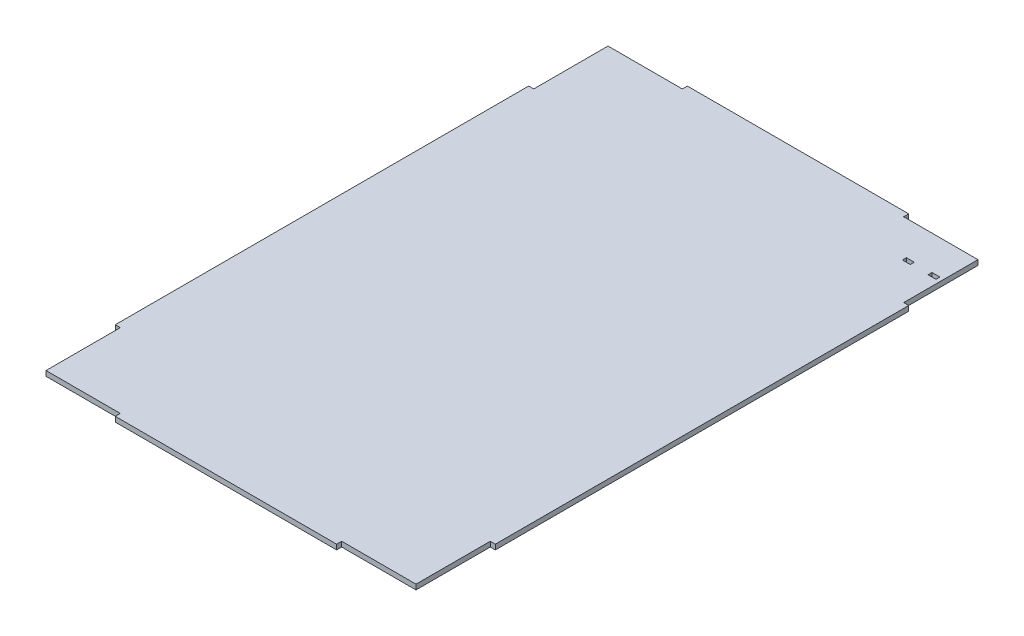
from build123d import *

# Parameters (mm, degrees)
SKETCH1_W           = 479
SKETCH1_H           = 721
BOSS_EXTRUDE1_DEPTH = 3.175
CUT_EXTRUDE1_DEPTH  = 433.851963724
SKETCH3_W           = 10
SKETCH3_H           = 5
CUT_EXTRUDE2_DEPTH  = 433.851963724


with BuildPart() as part:
    # Sketch1 → Boss-Extrude1 (new, symmetric)
    with BuildSketch(Plane(origin=(0, 0, 0), x_dir=(1, 0, 0), z_dir=(0, 1, 0))):
        Rectangle(SKETCH1_W, SKETCH1_H)
    extrude(amount=BOSS_EXTRUDE1_DEPTH, both=True)

    # Sketch2 → Cut-Extrude1 (cut, through all)
    with BuildSketch(Plane(origin=(0, 3.175, 0), x_dir=(1, 0, 0), z_dir=(0, 1, 0))):
        Polygon((-239.5, 360.5), (-239.5, 260.5), (-233.15, 260.5), (-233.15, 354.15), (-139.5, 354.15), (-139.5, 360.5), align=None)
        Polygon((239.5, 360.5), (139.5, 360.5), (139.5, 354.15), (233.15, 354.15), (233.15, 260.5), (239.5, 260.5), align=None)
        Polygon((239.5, -360.5), (239.5, -260.5), (233.15, -260.5), (233.15, -354.15), (139.5, -354.15), (139.5, -360.5), align=None)
        Polygon((-239.5, -360.5), (-139.5, -360.5), (-139.5, -354.15), (-233.15, -354.15), (-233.15, -260.5), (-239.5, -260.5), align=None)
    extrude(amount=-CUT_EXTRUDE1_DEPTH, mode=Mode.SUBTRACT)

    # Sketch3 → Cut-Extrude2 (cut, through all)
    with BuildSketch(Plane.XZ.offset(3.175)):
        with Locations((190.85, -308.65)):
            Rectangle(SKETCH3_W, SKETCH3_H)
        with Locations((223.15, -308.65)):
            Rectangle(SKETCH3_W, SKETCH3_H)
    extrude(amount=-CUT_EXTRUDE2_DEPTH, mode=Mode.SUBTRACT)


solid = part.part
